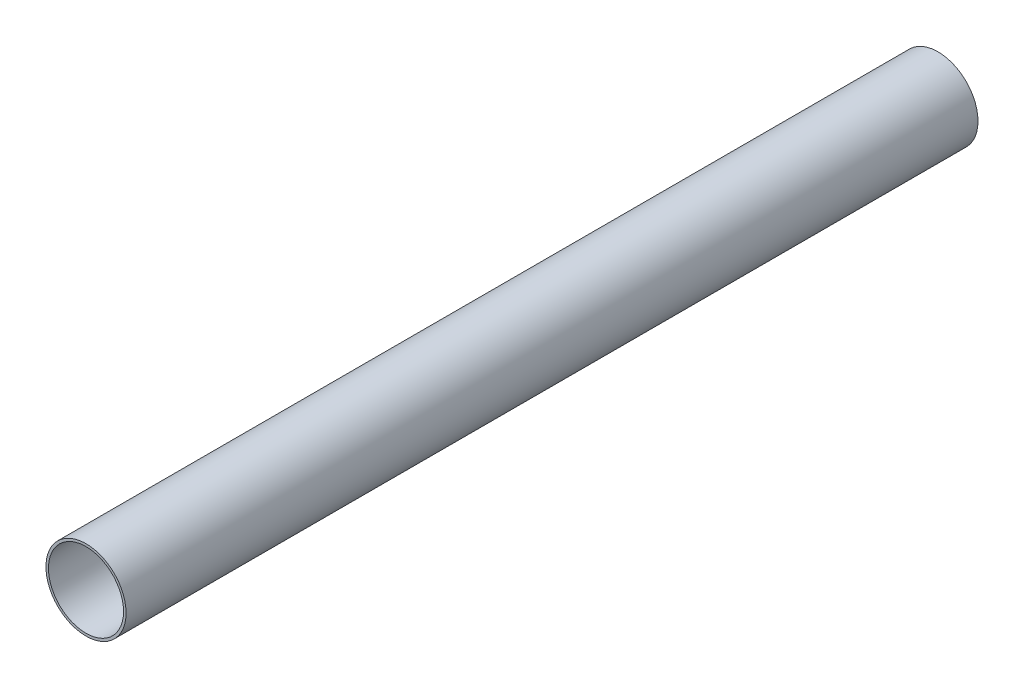
from build123d import *

# Parameters (mm, degrees)
SKETCH1_R           = 25.4
SKETCH1_R_2         = 23.8125
BOSS_EXTRUDE1_DEPTH = 270.100000058


with BuildPart() as part:
    # Sketch1 → Boss-Extrude1 (new, symmetric)
    with BuildSketch(Plane.XY):
        Circle(SKETCH1_R)
        Circle(SKETCH1_R_2, mode=Mode.SUBTRACT)
    extrude(amount=BOSS_EXTRUDE1_DEPTH, both=True)


solid = part.part
